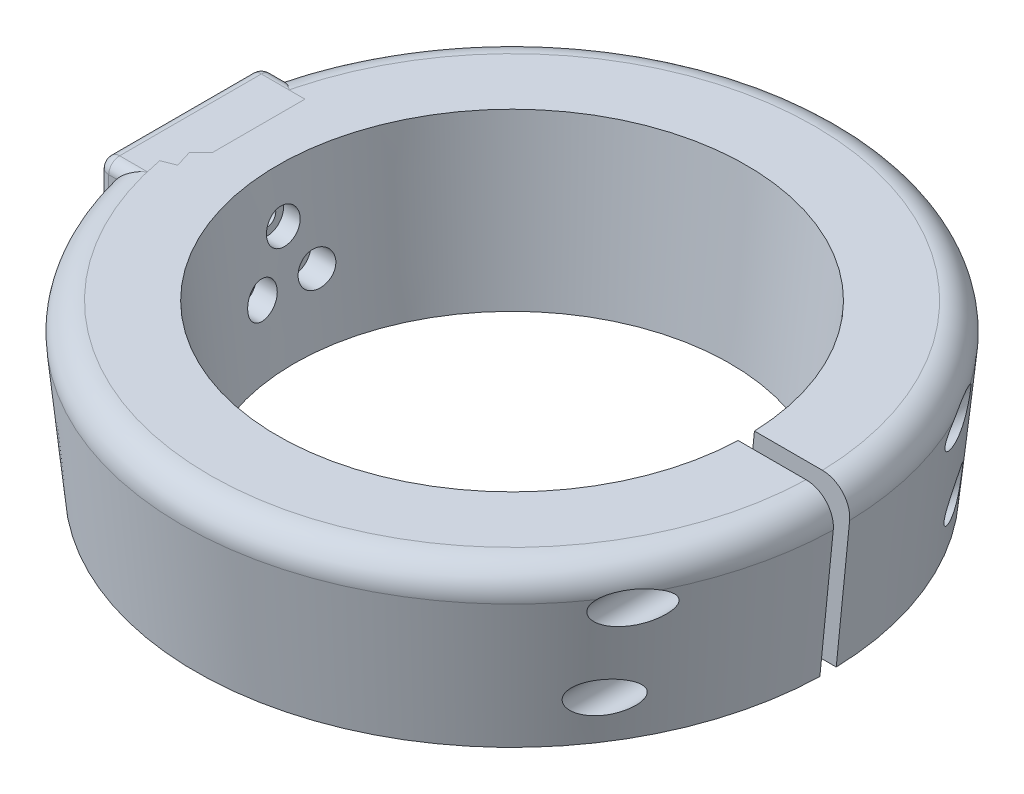
from build123d import *

# Parameters (mm, degrees)
CUT_EXTRUDE1_DEPTH  = 92.33454987024352
SKETCH4_R           = 1.6500000000000026
SKETCH4_R_2         = 1.6500000000000028
CUT_EXTRUDE2_DEPTH  = 88.561407023871
SKETCH6_R           = 3.0750000000000037
CUT_EXTRUDE3_DEPTH  = 96.928358700647
SKETCH7_R           = 2.1250000000000027
CUT_EXTRUDE4_DEPTH  = 89.61292246450292
BOSS_EXTRUDE1_DEPTH = 15
SKETCH9_R           = 1.6500000000000001
SKETCH9_R_2         = 1.6499999999999995
SKETCH9_R_3         = 1.65
CUT_EXTRUDE5_DEPTH  = 30
SKETCH10_R          = 3.075000000000001
SKETCH10_R_2        = 3.075
CUT_EXTRUDE6_DEPTH  = 45
FILLET1_R           = 5
FILLET2_R           = 2


with BuildPart() as part:
    # Sketch2 → Revolve1 (revolve)
    with BuildSketch(Plane(origin=(0, 0, 0), x_dir=(0, 0, -1), z_dir=(1, 0, 0)), mode=Mode.PRIVATE) as revolve1_sk:
        Polygon((-57.99999999999999, -15.00000000000001), (-61, 14.999999999999998), (-42.99999999999999, 14.999999999999998), (-40, -14.999999999999998), align=None)
    revolve(revolve1_sk.sketch.rotate(Axis((0, 0, 0), (0, 1, 0)), 180), axis=Axis((0, 0, 0), (0, 1, 0)))

    # Sketch3 → Cut-Extrude1 (cut, through all)
    with BuildSketch(Plane(origin=(0, 14.999999999999998, 0), x_dir=(1, 0, 0), z_dir=(0, 1, 0))):
        Polygon((113.65856504514353, -1.4999999999999876), (28.076371722461012, -1.500000000000003), (28.076371722461012, 1.4999999999999962), (113.65856504514353, 1.5000000000000135), align=None)
    extrude(amount=-CUT_EXTRUDE1_DEPTH, mode=Mode.SUBTRACT)

    # Sketch4 → Cut-Extrude2 (cut, through all)
    with BuildSketch(Plane.XY):
        with Locations(Location((51.97769191675172, 7.348320255297573, 0), (0, 0, 211.426587636))):
            Circle(SKETCH4_R)
        with Locations(Location((48.97623265460379, -7.348320255297574, 0), (0, 0, 209.882284238))):
            Circle(SKETCH4_R_2)
    extrude(amount=-CUT_EXTRUDE2_DEPTH, mode=Mode.SUBTRACT)

    # Sketch6 → Cut-Extrude3 (cut, through all)
    with BuildSketch(Plane.XY.offset(-11.499999999999991)):
        with Locations((51.97769191675172, 7.348320255297573)):
            Circle(SKETCH6_R)
        with Locations((48.97623265460379, -7.348320255297574)):
            Circle(SKETCH6_R)
    cut_extrude3 = extrude(amount=-CUT_EXTRUDE3_DEPTH, mode=Mode.SUBTRACT)

    # Mirror1: Cut-Extrude3 across plane
    add(cut_extrude3.mirror(Plane.XY), mode=Mode.SUBTRACT)

    # Sketch7 → Cut-Extrude4 (cut, through all)
    with BuildSketch(Plane(origin=(2.7e-16, 0, 1.5000000000000082), x_dir=(-1, 0, 1.8e-16), z_dir=(-1.8e-16, 0, -1))):
        with Locations((-51.97769191675173, 7.348320255297573)):
            Circle(SKETCH7_R)
        with Locations((-48.9762326546038, -7.348320255297574)):
            Circle(SKETCH7_R)
    extrude(amount=-CUT_EXTRUDE4_DEPTH, mode=Mode.SUBTRACT)


with BuildPart() as body_2:
    # Sketch8 → Boss-Extrude1 (new, symmetric)
    with BuildSketch(Plane.XY):
        Polygon((-61, 14.999999999999998), (-60.99999999999999, -15.000000000000009), (-50.99999999999999, -15.000000000000012), (-50.99999999999999, 14.999999999999998), align=None)
    extrude(amount=BOSS_EXTRUDE1_DEPTH, both=True)


with BuildPart() as cut_extrude5_tool:
    # Sketch9 → Cut-Extrude5 (new body)
    with BuildSketch(Plane.ZY.offset(61)):
        with Locations(Location((1.6e-16, 5.773502691896258, 0), (0, 0, 270))):
            Circle(SKETCH9_R)
        with Locations(Location((5, -2.8867513459481287, 0), (0, 0, 270))):
            Circle(SKETCH9_R_2)
        with Locations(Location((-5, -2.8867513459481287, 0), (0, 0, 270))):
            Circle(SKETCH9_R_3)
    extrude(amount=-CUT_EXTRUDE5_DEPTH)


with BuildPart() as part_1:
    add(part.part)

    # Cut-Extrude5: cut by cut_extrude5_tool
    add(cut_extrude5_tool.part, mode=Mode.SUBTRACT)

    # Sketch10 → Cut-Extrude6 (cut)
    with BuildSketch(Plane(origin=(0, 0, 0), x_dir=(0, 0, -1), z_dir=(1, 0, 0))):
        with Locations((5, -2.8867513459481353)):
            Circle(SKETCH10_R)
        with Locations((-5, -2.8867513459481353)):
            Circle(SKETCH10_R_2)
        with Locations((-1.6e-16, 5.773502691896251)):
            Circle(SKETCH10_R_2)
    extrude(amount=-CUT_EXTRUDE6_DEPTH, mode=Mode.SUBTRACT)

    # Fillet1
    # the kernel refuses this fillet: 5 mm, written as the material it takes off along each edge
    with BuildSketch(Plane(origin=(0, 14.999999999999998, 0), x_dir=(0.9999950652018581, 0, 0.0031415874859023764), z_dir=(0.0031415874859023764, 0, -0.9999950652018581))) as fillet1_piece_1:
        with BuildLine():
            CenterArc((61.00000000000001 - FILLET1_R * 1.10498756211, FILLET1_R), FILLET1_R, 270.00000000000006, 95.71059313749959)
            Line((61.00000000000001 - FILLET1_R * 1.10498756211, -1.78e-15), (61.00000000000001, 0))
            Line((61.00000000000001, 0), (61.00000000000001 - FILLET1_R * 0.109950371902, FILLET1_R * 1.09950371902))
        make_face()
    revolve(axis=Axis((0, 14.999999999999998, 0), (0, -1, 0)), revolution_arc=359.63999999999993, mode=Mode.SUBTRACT)


with BuildPart() as body_2_1:
    add(body_2.part)

    # Cut-Extrude5: cut by cut_extrude5_tool
    add(cut_extrude5_tool.part, mode=Mode.SUBTRACT)

    # Fillet2
    fillet2_edges = [body_2_1.edges().sort_by_distance(p)[0] for p in [
        (-56, 14.999999999999998, 15),
        (-61, -5.33e-15, -15),
        (-56, 14.999999999999998, -15),
        (-60.99999999999999, -15.000000000000009, 0),
        (-61, 14.999999999999998, 0),
        (-61, -5.33e-15, 15),
    ]]
    fillet(fillet2_edges, radius=FILLET2_R)


solid = Compound([part_1.part, body_2_1.part])
